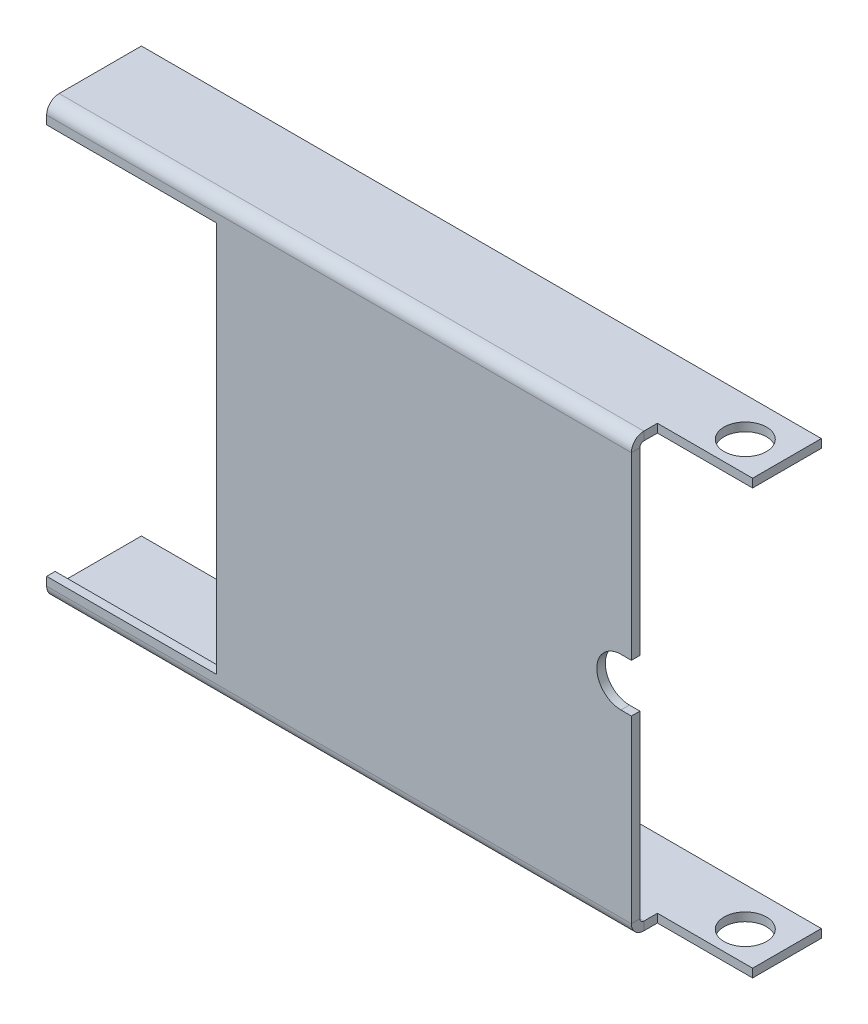
from build123d import *

# Parameters (mm, degrees)
SKETCH1_W              = 127
SKETCH1_H              = 111.76
BASE_FLANGE1_DEPTH     = 1.5875
SKETCHED_START         = -63.5
SKETCHED_BEND1_DEPTH   = 127
SKETCHED_BEND1_2_DEPTH = 127
CUT_EXTRUDE2_START     = -2.3241
CUT_EXTRUDE2_OUTLINE_W = 17.78
CUT_EXTRUDE2_OUTLINE_H = 84
CUT_EXTRUDE2_DEPTH     = 2.3241
CUT_EXTRUDE1_REACH     = 106.317
SKETCH6_R              = 3.96875
CUT_EXTRUDE3_DEPTH     = 78.328235904
SKETCH34_W             = 31.75
SKETCH34_H             = 73.025
CUT_EXTRUDE5_DEPTH     = 2.54
CUT_EXTRUDE6_REACH     = 106.317
SKETCH49_W             = 17.78
SKETCH49_H             = 2.54


# Read off the part's stored shape, not the designer's step: Sketched Bend1, Cut-Extrude2
# Sheet-metal steps are written as plain solids
with BuildPart() as part:
    # Sketch1 → Base-Flange1 (new body)
    with BuildSketch(Plane.XY):
        Rectangle(SKETCH1_W, SKETCH1_H)
    extrude(amount=-BASE_FLANGE1_DEPTH)

    # Sketched Bend1 outline → Sketched Bend1 (cut)
    with BuildSketch(Plane.YZ.offset(SKETCHED_START)):
        with BuildLine():
            ThreePointArc((38.1, 0), (39.458217352, -0.438182071), (40.304282479, -1.5875))
            Line((40.304282479, -1.5875), (55.88, -1.5875))
            Line((55.88, -1.5875), (55.88, 0))
            Line((55.88, 0), (38.1, 0))
        make_face()
        with BuildLine():
            Line((-55.88, -1.5875), (-40.304282479, -1.5875))
            ThreePointArc((-40.304282479, -1.5875), (-39.458217352, -0.438182071), (-38.1, 0))
            Line((-38.1, 0), (-55.88, 0))
            Line((-55.88, 0), (-55.88, -1.5875))
        make_face()
    extrude(amount=SKETCHED_BEND1_DEPTH, mode=Mode.SUBTRACT)

    # Sketched Bend1 2 outline → Sketched Bend1 2 (add)
    with BuildSketch(Plane.YZ.offset(SKETCHED_START)):
        with BuildLine():
            ThreePointArc((38.1, -1.5875), (38.620854855, -1.803245145), (38.8366, -2.3241))
            Line((38.8366, -2.3241), (38.8366, -17.700231841))
            Line((38.8366, -17.700231841), (40.4241, -17.700231841))
            Line((40.4241, -17.700231841), (40.4241, -2.3241))
            ThreePointArc((40.4241, -2.3241), (40.393950056, -1.950959343), (40.304282479, -1.5875))
            Line((40.304282479, -1.5875), (38.1, -1.5875))
        make_face()
        with BuildLine():
            ThreePointArc((-38.8366, -2.3241), (-38.620854855, -1.803245145), (-38.1, -1.5875))
            Line((-38.1, -1.5875), (-40.304282479, -1.5875))
            ThreePointArc((-40.304282479, -1.5875), (-40.393950056, -1.950959343), (-40.4241, -2.3241))
            Line((-40.4241, -2.3241), (-40.4241, -17.700231841))
            Line((-40.4241, -17.700231841), (-38.8366, -17.700231841))
            Line((-38.8366, -17.700231841), (-38.8366, -2.3241))
        make_face()
    extrude(amount=SKETCHED_BEND1_2_DEPTH)

    # Cut-Extrude2 outline → Cut-Extrude2 (cut)
    with BuildSketch(Plane.XY.offset(CUT_EXTRUDE2_START)):
        with Locations((54.61, 0)):
            Rectangle(CUT_EXTRUDE2_OUTLINE_W, CUT_EXTRUDE2_OUTLINE_H)
    extrude(amount=CUT_EXTRUDE2_DEPTH, mode=Mode.SUBTRACT)

    # Cut-Extrude1: up to this face of the body (flat: up to its plane)
    cut_extrude1_end = Plane(part.part.faces().sort_by_distance((0, -40.4241, -10.012165921))[0])
    # Sketch6 → Cut-Extrude1 (cut, up to the picked face)
    with BuildSketch(Plane(origin=(0, 40.4241, 0), x_dir=(1, 0, 0), z_dir=(0, 1, 0)), mode=Mode.PRIVATE) as cut_extrude1_sk1:
        with Locations(Location((56.515, 10.4775, 0), (0, 0, 270))):
            Circle(SKETCH6_R)
    cut_extrude1_tool1 = split(extrude(cut_extrude1_sk1.sketch, amount=-CUT_EXTRUDE1_REACH, mode=Mode.PRIVATE), bisect_by=cut_extrude1_end, keep=Keep.BOTH, mode=Mode.PRIVATE)
    add(cut_extrude1_tool1.solids().sort_by(Axis((56.515, 40.4241, -10.4775), (0, -1, 0)))[0], mode=Mode.SUBTRACT)

    # Sketch13 → Cut-Extrude3 (cut, through all)
    with BuildSketch(Plane.XY):
        with BuildLine():
            ThreePointArc((45.72, 4.050728383), (44.765416013, 4.386244277), (43.76000011, 4.5))
            ThreePointArc((43.76000011, 4.5), (39.26000011, 0), (43.76000011, -4.5))
            ThreePointArc((43.76000011, -4.5), (44.765416013, -4.386244277), (45.72, -4.050728383))
            Line((45.72, -4.050728383), (45.72, 4.050728383))
        make_face()
        with BuildLine():
            ThreePointArc((48.26000011, 0), (47.572479586, 2.390606669), (45.72, 4.050728383))
            Line((45.72, 4.050728383), (45.72, -4.050728383))
            ThreePointArc((45.72, -4.050728383), (47.572479586, -2.390606669), (48.26000011, 0))
        make_face()
        with BuildLine():
            Line((45.72, 4.5), (43.76000011, 4.5))
            ThreePointArc((43.76000011, 4.5), (44.765416013, 4.386244277), (45.72, 4.050728383))
            Line((45.72, 4.050728383), (45.72, 4.5))
        make_face()
        with BuildLine():
            ThreePointArc((45.72, -4.050728383), (44.765416013, -4.386244277), (43.76000011, -4.5))
            Line((43.76000011, -4.5), (45.72, -4.5))
            Line((45.72, -4.5), (45.72, -4.050728383))
        make_face()
    extrude(amount=-CUT_EXTRUDE3_DEPTH, mode=Mode.SUBTRACT)

    # Sketch34 → Cut-Extrude5 (cut)
    with BuildSketch(Plane.XY):
        with Locations((-47.625, 0)):
            Rectangle(SKETCH34_W, SKETCH34_H)
    extrude(amount=-CUT_EXTRUDE5_DEPTH, mode=Mode.SUBTRACT)

    # Cut-Extrude6: up to this face of the body (flat: up to its plane)
    cut_extrude6_end = Plane(part.part.faces().sort_by_distance((-1.469322503, 40.4241, -10.00006779))[0])
    # Sketch49 → Cut-Extrude6 (cut, up to the picked face)
    with BuildSketch(Plane.XZ.offset(40.4241), mode=Mode.PRIVATE) as cut_extrude6_sk1:
        with Locations((54.61, -3.5941)):
            Rectangle(SKETCH49_W, SKETCH49_H)
    cut_extrude6_tool1 = split(extrude(cut_extrude6_sk1.sketch, amount=-CUT_EXTRUDE6_REACH, mode=Mode.PRIVATE), bisect_by=cut_extrude6_end, keep=Keep.BOTH, mode=Mode.PRIVATE)
    add(cut_extrude6_tool1.solids().sort_by(Axis((54.61, -40.4241, -3.5941), (0, 1, 0)))[0], mode=Mode.SUBTRACT)


solid = part.part
